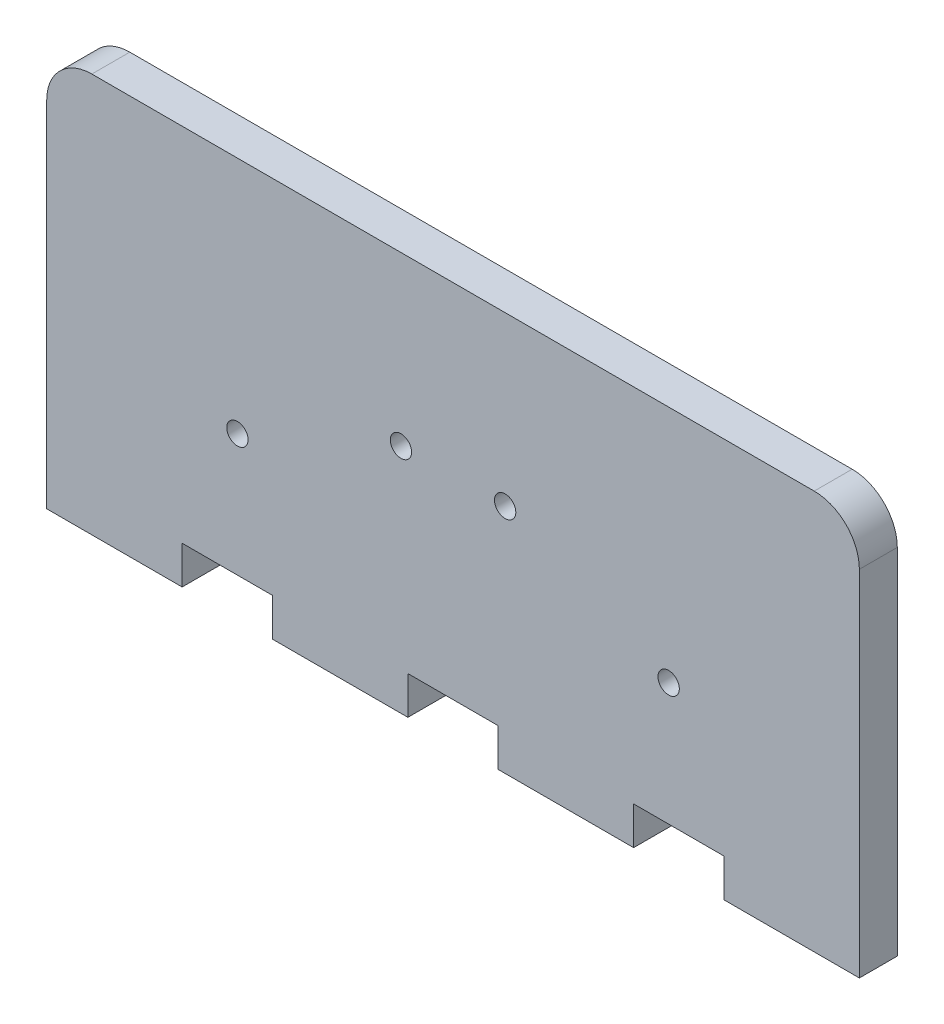
from build123d import *

# Parameters (mm, degrees)
SKETCH1_W           = 114.3
SKETCH1_H           = 56.134
BOSS_EXTRUDE1_DEPTH = 5.334
SKETCH2_W           = 12.7
SKETCH2_H           = 5.334
CUT_EXTRUDE1_DEPTH  = 90.417531181
FILLET1_R           = 6.35
SKETCH3_R           = 1.5
CUT_EXTRUDE2_DEPTH  = 90.417531181


with BuildPart() as part:
    # Sketch1 → Boss-Extrude1 (new body)
    with BuildSketch(Plane.XY):
        with Locations((26.61749153, -2.755892293)):
            Rectangle(SKETCH1_W, SKETCH1_H)
    extrude(amount=BOSS_EXTRUDE1_DEPTH)

    # Sketch2 → Cut-Extrude1 (cut, through all)
    with BuildSketch(Plane.XY.offset(5.334)):
        with Locations((-5.13250847, -28.155892293)):
            Rectangle(SKETCH2_W, SKETCH2_H)
        with Locations((26.61749153, -28.155892293)):
            Rectangle(SKETCH2_W, SKETCH2_H)
        with Locations((58.36749153, -28.155892293)):
            Rectangle(SKETCH2_W, SKETCH2_H)
    extrude(amount=-CUT_EXTRUDE1_DEPTH, mode=Mode.SUBTRACT)

    # Fillet1
    fillet1_edges = [part.edges().sort_by_distance(p)[0] for p in [
        (83.76749153, 25.311107707, 2.667),
        (-30.53250847, 25.311107707, 2.667),
    ]]
    fillet(fillet1_edges, radius=FILLET1_R)

    # Sketch3 → Cut-Extrude2 (cut, through all)
    with BuildSketch(Plane(origin=(0, 0, 0), x_dir=(-1, 0, 0), z_dir=(0, 0, -1))):
        with Locations((3.70850847, -8.264892293)):
            Circle(SKETCH3_R)
        with Locations((-19.29149153, 1.735107707)):
            Circle(SKETCH3_R)
        with Locations((-56.94349153, -8.264892293)):
            Circle(SKETCH3_R)
        with Locations((-33.94349153, 1.735107707)):
            Circle(SKETCH3_R)
    extrude(amount=-CUT_EXTRUDE2_DEPTH, mode=Mode.SUBTRACT)


solid = part.part
